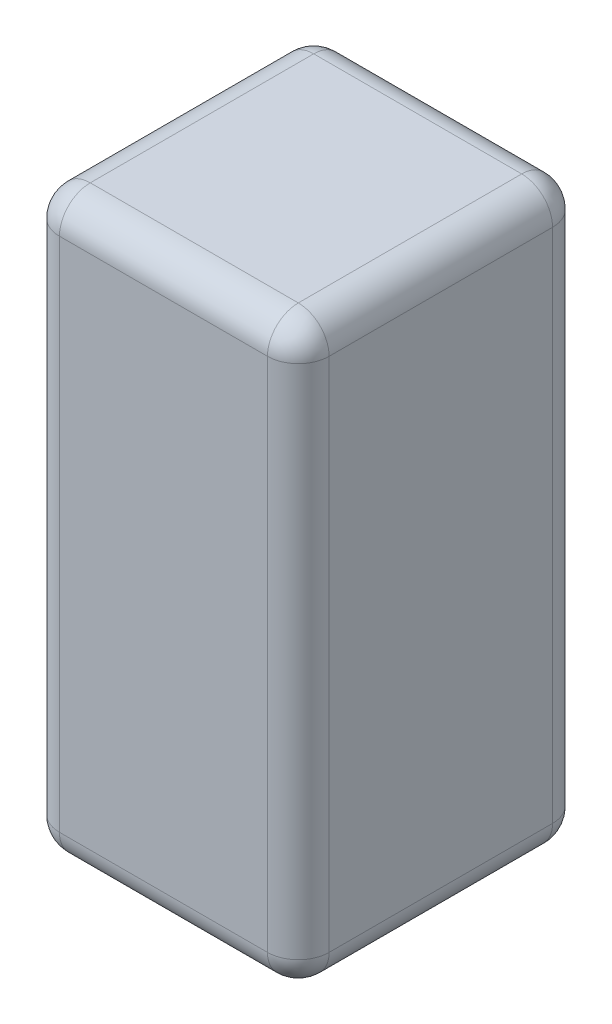
from build123d import *

# Parameters (mm, degrees)
SKETCH2_W           = 35
SKETCH2_H           = 75
BOSS_EXTRUDE1_DEPTH = 37
FILLET1_R           = 4


with BuildPart() as part:
    # Sketch2 → Boss-Extrude1 (new body)
    with BuildSketch(Plane.XY.offset(4)):
        Rectangle(SKETCH2_W, SKETCH2_H)
    extrude(amount=BOSS_EXTRUDE1_DEPTH)

    # Fillet1
    fillet1_edges = [part.edges().sort_by_distance(p)[0] for p in [
        (17.5, 0, 4),
        (17.5, 0, 41),
        (0, -37.5, 41),
        (0, -37.5, 4),
        (-17.5, 0, 4),
        (-17.5, 0, 41),
        (0, 37.5, 41),
        (0, 37.5, 4),
        (17.5, 37.5, 22.5),
        (-17.5, 37.5, 22.5),
        (17.5, -37.5, 22.5),
        (-17.5, -37.5, 22.5),
    ]]
    fillet(fillet1_edges, radius=FILLET1_R)


solid = part.part
